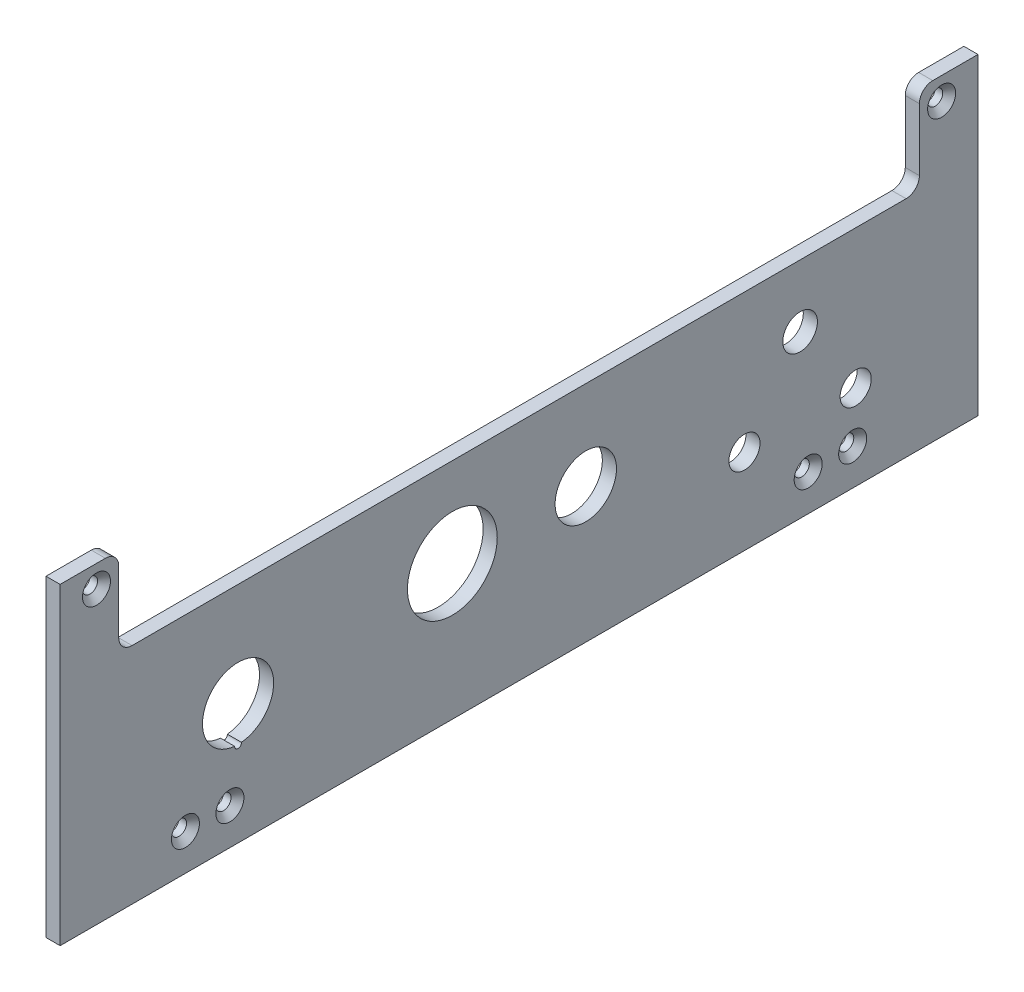
from build123d import *

# Parameters (mm, degrees)
BOSS_EXTRUDE1_DEPTH                             = 3.175
CSK_FOR_M3_FLAT_HEAD_MACHINE_SCREW1_D           = 3.4
CSK_FOR_M3_FLAT_HEAD_MACHINE_SCREW1_CSINK_D     = 6.3
CSK_FOR_M3_FLAT_HEAD_MACHINE_SCREW1_CSINK_ANGLE = 90
SKETCH4_R                                       = 6.9
SKETCH4_R_2                                     = 3.9
SKETCH4_R_3                                     = 3.5
SKETCH4_R_4                                     = 10.1
CUT_EXTRUDE1_DEPTH                              = 125.917107515


with BuildPart() as part:
    # Sketch1 → Boss-Extrude1 (new body)
    with BuildSketch(Plane(origin=(0, 0, 0), x_dir=(0, 0, -1), z_dir=(1, 0, 0))):
        with BuildLine():
            Line((103.175, 0), (103.175, 3.175))
            Line((103.175, 3.175), (103.175, 47.175))
            Line((103.175, 47.175), (103.175, 50.35))
            Line((103.175, 50.35), (103.175, 70.35))
            Line((103.175, 70.35), (93, 70.35))
            ThreePointArc((93, 70.35), (90.878679656, 69.471320344), (90, 67.35))
            Line((90, 67.35), (90, 53.35))
            ThreePointArc((90, 53.35), (89.121320344, 51.228679656), (87, 50.35))
            Line((87, 50.35), (-87, 50.35))
            ThreePointArc((-87, 50.35), (-89.121320344, 51.228679656), (-90, 53.35))
            Line((-90, 53.35), (-90, 67.35))
            ThreePointArc((-90, 67.35), (-90.878679656, 69.471320344), (-93, 70.35))
            Line((-93, 70.35), (-103.175, 70.35))
            Line((-103.175, 70.35), (-103.175, 50.35))
            Line((-103.175, 50.35), (-103.175, 47.175))
            Line((-103.175, 47.175), (-103.175, 3.175))
            Line((-103.175, 3.175), (-103.175, 0))
            Line((-103.175, 0), (103.175, 0))
        make_face()
    extrude(amount=BOSS_EXTRUDE1_DEPTH)

    # CSK for M3 Flat Head Machine Screw1 (through all)
    with Locations(Plane(origin=(3.175, 0, 0), x_dir=(0, 0, -1), z_dir=(1, 0, 0))):
        with Locations((-75, 8.175), (-65, 8.175), (-95, 65.35)):
            csk_for_m3_flat_head_machine_screw1 = CounterSinkHole(CSK_FOR_M3_FLAT_HEAD_MACHINE_SCREW1_D / 2, CSK_FOR_M3_FLAT_HEAD_MACHINE_SCREW1_CSINK_D / 2, counter_sink_angle=CSK_FOR_M3_FLAT_HEAD_MACHINE_SCREW1_CSINK_ANGLE)

    # Mirror1: CSK for M3 Flat Head Machine Screw1 across plane
    add(csk_for_m3_flat_head_machine_screw1.mirror(Plane.XY), mode=Mode.SUBTRACT)

    # Sketch4 → Cut-Extrude1 (cut, through all)
    with BuildSketch(Plane(origin=(3.175, 0, 0), x_dir=(0, 0, -1), z_dir=(1, 0, 0))):
        with Locations((15, 30.35)):
            Circle(SKETCH4_R)
        with Locations((63.175, 36.35)):
            Circle(SKETCH4_R_2)
        with Locations((50.675, 19.175)):
            Circle(SKETCH4_R_3)
        with Locations((75.675, 19.175)):
            Circle(SKETCH4_R_3)
        with Locations((-15, 30.35)):
            Circle(SKETCH4_R_4)
        with BuildLine():
            ThreePointArc((-62.400909683, 19.212539062), (-63.175, 35.175), (-63.949090317, 19.212539062))
            ThreePointArc((-63.949090317, 19.212539062), (-63.175, 18.4), (-62.400909683, 19.212539062))
        make_face()
    extrude(amount=-CUT_EXTRUDE1_DEPTH, mode=Mode.SUBTRACT)


solid = part.part
